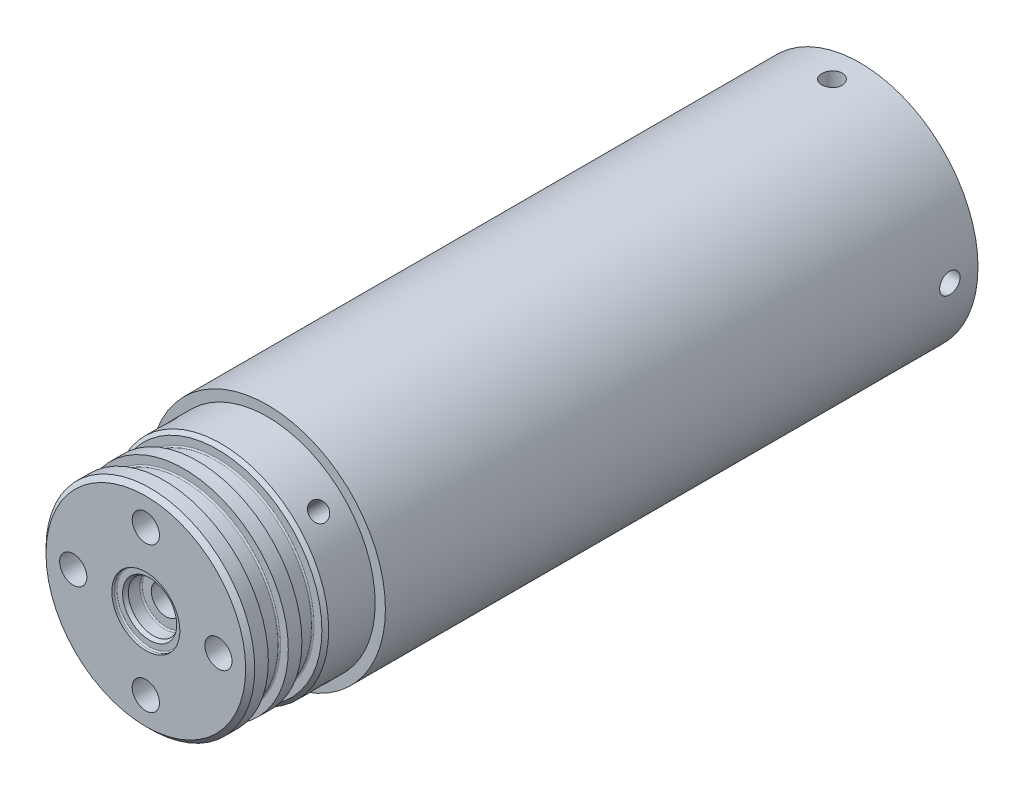
from build123d import *

# Parameters (mm, degrees)
BOSS_EXTRUDE2_START = -25
SKETCH18_R          = 20
SKETCH18_R_2        = 1.5
BOSS_EXTRUDE2_DEPTH = 25
SKETCH35_R          = 6.4
CUT_EXTRUDE11_DEPTH = 15.6
SKETCH25_R          = 3
CUT_EXTRUDE3_DEPTH  = 16.5
SKETCH23_R          = 11
CUT_EXTRUDE2_DEPTH  = 1.5
SKETCH24_R          = 3.25
CUT_EXTRUDE12_DEPTH = 25
SKETCH26_R          = 26
SKETCH26_R_2        = 21
BOSS_EXTRUDE4_DEPTH = 67.6
CUT_EXTRUDE4_START  = -26.8
SKETCH27_R          = 22.25
SKETCH27_R_2        = 21
CUT_EXTRUDE4_DEPTH  = 26.8
SKETCH32_R          = 2
CUT_EXTRUDE8_DEPTH  = 6
CIRPATTERN2_COUNT   = 3
CIRPATTERN2_ANGLE   = 180
SKETCH38_R          = 2.25
CUT_EXTRUDE14_DEPTH = 10
CIRPATTERN3_COUNT   = 4
SKETCH39_R          = 5.5
CUT_EXTRUDE15_DEPTH = 4.45
SKETCH40_R          = 7.5
CUT_EXTRUDE16_DEPTH = 0.85
SKETCH45_R          = 22.45
CUT_EXTRUDE20_DEPTH = 26.8
CUT_EXTRUDE21_START = -0.2
SKETCH46_R          = 26
CUT_EXTRUDE21_DEPTH = 0.2
CHAMFER4_SIZE       = 1.5
FILLET1_R           = 0.3
FILLET2_R           = 0.3


with BuildPart() as part:
    # Sketch8 → Revolve1 (revolve)
    with BuildSketch(Plane(origin=(0, 0, 0), x_dir=(0, 0, -1), z_dir=(1, 0, 0)), mode=Mode.PRIVATE) as revolve1_sk:
        Polygon((-90, 20), (-31, 20), (-30, 21), (0, 21), (0, 26), (-63.2, 26), (-63.2, 23.75), (-73.45, 23.75), (-74.2, 23), (-74.2, 21), (-78.6, 21), (-78.6, 23), (-81.6, 23), (-81.6, 21), (-86, 21), (-86, 23), (-89, 23), (-90, 22), align=None)
    revolve(revolve1_sk.sketch.rotate(Axis((0, 0, 90), (0, 0, -1)), 90), axis=Axis((0, 0, 90), (0, 0, -1)))

    # Sketch18 → Boss-Extrude2 (add)
    with BuildSketch(Plane.XY.offset(90).offset(BOSS_EXTRUDE2_START)):
        Circle(SKETCH18_R)
        with Locations((0, 16)):
            Circle(SKETCH18_R_2, mode=Mode.SUBTRACT)
        with Locations((16, 0)):
            Circle(SKETCH18_R_2, mode=Mode.SUBTRACT)
        with Locations((0, -16)):
            Circle(SKETCH18_R_2, mode=Mode.SUBTRACT)
        with Locations((-16, 0)):
            Circle(SKETCH18_R_2, mode=Mode.SUBTRACT)
    extrude(amount=BOSS_EXTRUDE2_DEPTH)

    # Sketch35 → Cut-Extrude11 (cut)
    with BuildSketch(Plane(origin=(0, 0, 65), x_dir=(-1, 0, 0), z_dir=(0, 0, -1))):
        Circle(SKETCH35_R)
    extrude(amount=-CUT_EXTRUDE11_DEPTH, mode=Mode.SUBTRACT)

    # Sketch25 → Cut-Extrude3 (cut)
    with BuildSketch(Plane.XY.offset(90)):
        with Locations((0, 16)):
            Circle(SKETCH25_R)
        with Locations((16, 0)):
            Circle(SKETCH25_R)
        with Locations((0, -16)):
            Circle(SKETCH25_R)
        with Locations((-16, 0)):
            Circle(SKETCH25_R)
    extrude(amount=-CUT_EXTRUDE3_DEPTH, mode=Mode.SUBTRACT)

    # Sketch23 → Cut-Extrude2 (cut)
    with BuildSketch(Plane(origin=(0, 0, 65), x_dir=(-1, 0, 0), z_dir=(0, 0, -1))):
        Circle(SKETCH23_R)
    extrude(amount=-CUT_EXTRUDE2_DEPTH, mode=Mode.SUBTRACT)

    # Sketch24 → Cut-Extrude12 (cut)
    with BuildSketch(Plane.XY.offset(90)):
        Circle(SKETCH24_R)
    extrude(amount=-CUT_EXTRUDE12_DEPTH, mode=Mode.SUBTRACT)

    # Sketch26 → Boss-Extrude4 (add)
    with BuildSketch(Plane(origin=(0, 0, 0), x_dir=(-1, 0, 0), z_dir=(0, 0, -1))):
        with Locations(Location((0, 0, 0), (0, 0, 180))):
            Circle(SKETCH26_R)
        with Locations(Location((0, 0, 0), (0, 0, 180))):
            Circle(SKETCH26_R_2, mode=Mode.SUBTRACT)
    extrude(amount=BOSS_EXTRUDE4_DEPTH)

    # Sketch27 → Cut-Extrude4 (cut)
    with BuildSketch(Plane(origin=(0, 0, -67.6), x_dir=(-1, 0, 0), z_dir=(0, 0, -1)).offset(CUT_EXTRUDE4_START)):
        Circle(SKETCH27_R)
        with Locations(Location((0, 0, 0), (0, 0, 180))):
            Circle(SKETCH27_R_2, mode=Mode.SUBTRACT)
    extrude(amount=CUT_EXTRUDE4_DEPTH, mode=Mode.SUBTRACT)

    # Sketch32 → Cut-Extrude8 (cut)
    with BuildSketch(Plane(origin=(-16.793786053, 16.793786053, 0), x_dir=(0, 0, 1), z_dir=(-0.7071067811865487, 0.7071067811865465, 0))):
        with Locations(Location((68.7, 0, 0), (0, 0, 270))):
            Circle(SKETCH32_R)
    cut_extrude8 = extrude(amount=-CUT_EXTRUDE8_DEPTH, mode=Mode.SUBTRACT)

    # CirPattern2: Cut-Extrude8 ×3 about axis
    cirpattern2_axis = Axis((0, 0, 0), (0, 0, -1))
    for i in range(1, CIRPATTERN2_COUNT):
        add(cut_extrude8.rotate(cirpattern2_axis, i * CIRPATTERN2_ANGLE / (CIRPATTERN2_COUNT - 1)), mode=Mode.SUBTRACT)

    # Sketch38 → Cut-Extrude14 (cut)
    with BuildSketch(Plane(origin=(0, 26, 0), x_dir=(1, 0, 0), z_dir=(0, 1, 0))):
        with Locations(Location((0, 61.2, 0), (0, 0, 270))):
            Circle(SKETCH38_R)
    cut_extrude14 = extrude(amount=-CUT_EXTRUDE14_DEPTH, mode=Mode.SUBTRACT)

    # CirPattern3: Cut-Extrude14 ×4 about axis
    cirpattern3_axis = Axis((0, 0, -67.6), (0, 0, -1))
    for i in range(1, CIRPATTERN3_COUNT):
        add(cut_extrude14.rotate(cirpattern3_axis, i * 360 / CIRPATTERN3_COUNT), mode=Mode.SUBTRACT)

    # Sketch39 → Cut-Extrude15 (cut)
    with BuildSketch(Plane.XY.offset(90)):
        Circle(SKETCH39_R)
    extrude(amount=-CUT_EXTRUDE15_DEPTH, mode=Mode.SUBTRACT)

    # Sketch40 → Cut-Extrude16 (cut)
    with BuildSketch(Plane.XY.offset(90)):
        Circle(SKETCH40_R)
    extrude(amount=-CUT_EXTRUDE16_DEPTH, mode=Mode.SUBTRACT)

    # Sketch45 → Cut-Extrude20 (cut)
    with BuildSketch(Plane(origin=(0, 0, -67.6), x_dir=(-1, 0, 0), z_dir=(0, 0, -1))):
        Circle(SKETCH45_R)
    extrude(amount=-CUT_EXTRUDE20_DEPTH, mode=Mode.SUBTRACT)

    # Sketch46 → Cut-Extrude21 (cut)
    with BuildSketch(Plane(origin=(0, 0, -67.6), x_dir=(-1, 0, 0), z_dir=(0, 0, -1)).offset(CUT_EXTRUDE21_START)):
        with Locations(Location((0, 0, 0), (0, 0, 180))):
            Circle(SKETCH46_R)
    extrude(amount=CUT_EXTRUDE21_DEPTH, mode=Mode.SUBTRACT)

    # Chamfer4
    # the kernel refuses this chamfer: 1.5 mm, written as the material it takes off along each edge
    with BuildSketch(Plane(origin=(0, 0, -40.8), x_dir=(1, 0, 0), z_dir=(0, 1, 0))) as chamfer4_piece_1_section:
        Polygon((21, -CHAMFER4_SIZE), (21 + CHAMFER4_SIZE, 0), (21, 0), align=None)
    chamfer4_piece_1 = revolve(axis=Axis((0, 0, -40.8), (0, 0, -1)), mode=Mode.PRIVATE)
    chamfer4_piece_1 = chamfer4_piece_1 & Plane(origin=(0, 0, -40.042668068), x_dir=(-1, 0, 0), z_dir=(0, 0, -1)) * Cylinder(22.45, 90, mode=Mode.PRIVATE)
    add(chamfer4_piece_1, mode=Mode.SUBTRACT)

    # Fillet1
    fillet1_edges = [part.edges().sort_by_distance(p)[0] for p in [
        (-21, 0, 86),
        (-21, 0, 81.6),
        (-21, 0, 78.6),
        (-21, 0, 74.2),
    ]]
    fillet(fillet1_edges, radius=FILLET1_R)

    # Sketch47 → Cut-Revolve1 (revolve, cut)
    with BuildSketch(Plane(origin=(0, 0, 0), x_dir=(0, 0, -1), z_dir=(1, 0, 0)), mode=Mode.PRIVATE) as cut_revolve1_sk:
        Polygon((-89.15, 5.961880215), (-89.15, 5.5), (-88.35, 5.5), align=None)
    revolve(cut_revolve1_sk.sketch.rotate(Axis((0, 0, 90), (0, 0, -1)), 270), axis=Axis((0, 0, 90), (0, 0, -1)), mode=Mode.SUBTRACT)

    # Fillet2
    fillet2_edges = [part.edges().sort_by_distance(p)[0] for p in [
        (-5.5, 0, 85.55),
        (-7.5, 0, 89.15),
    ]]
    fillet(fillet2_edges, radius=FILLET2_R)


solid = part.part
